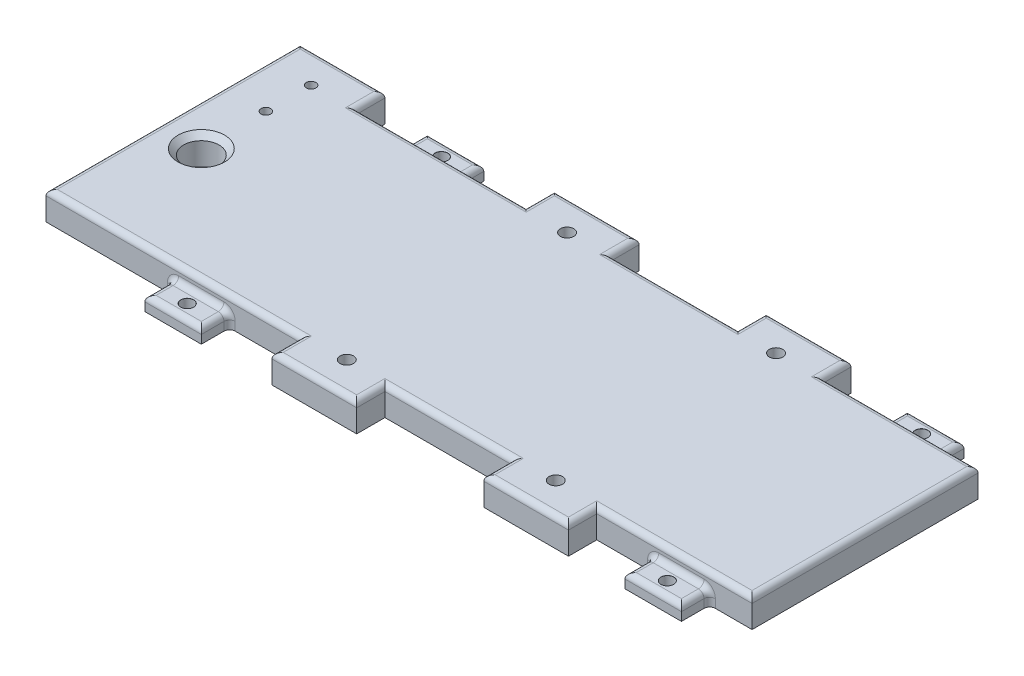
from build123d import *

# Parameters (mm, degrees)
SKETCH1_W                      = 260
SKETCH1_H                      = 100
BOSS_EXTRUDE1_DEPTH            = 10
SKETCH3_W                      = 55
SKETCH3_H                      = 10
SKETCH3_W_2                    = 60
SKETCH3_W_3                    = 45
CUT_EXTRUDE2_DEPTH             = 140.642400438
SKETCH5_W                      = 20
SKETCH5_H                      = 10
BOSS_EXTRUDE2_DEPTH            = 5
FILLET1_R                      = 2
SKETCH2_R                      = 6.25
CUT_EXTRUDE1_DEPTH             = 140.642400438
CHAMFER1_SIZE                  = 2
SKETCH4_R                      = 2.375
CUT_EXTRUDE3_DEPTH             = 6.2
M4_CLEARANCE_HOLE1_D           = 4.5
M4_CLEARANCE_HOLE1_CSINK_D     = 4.55
M4_CLEARANCE_HOLE1_CSINK_ANGLE = 90
M3_CLEARANCE_HOLE1_D           = 3.4
SKETCH13_R                     = 3.5
CUT_EXTRUDE4_DEPTH             = 5


with BuildPart() as part:
    # Sketch1 → Boss-Extrude1 (new body)
    with BuildSketch(Plane(origin=(0, 0, 0), x_dir=(1, 0, 0), z_dir=(0, 1, 0))):
        Rectangle(SKETCH1_W, SKETCH1_H)
    extrude(amount=BOSS_EXTRUDE1_DEPTH)

    # Sketch3 → Cut-Extrude2 (cut, through all)
    with BuildSketch(Plane(origin=(0, 10, 0), x_dir=(1, 0, 0), z_dir=(0, 1, 0))):
        with Locations((102.5, 45)):
            Rectangle(SKETCH3_W, SKETCH3_H)
        with Locations((102.5, -45)):
            Rectangle(SKETCH3_W, SKETCH3_H)
        Polygon((-130, -50), (-30, -50), (-30, -40), (-120, -40), (-120, 50), (-130, 50), (-130, -40), align=None)
        with Locations((-60, 45)):
            Rectangle(SKETCH3_W_2, SKETCH3_H)
        with Locations((22.5, 45)):
            Rectangle(SKETCH3_W_3, SKETCH3_H)
        with Locations((22.5, -45)):
            Rectangle(SKETCH3_W_3, SKETCH3_H)
    extrude(amount=-CUT_EXTRUDE2_DEPTH, mode=Mode.SUBTRACT)

    # Sketch5 → Boss-Extrude2 (add)
    with BuildSketch(Plane.XZ):
        with Locations((-65, 45)):
            Rectangle(SKETCH5_W, SKETCH5_H)
        with Locations((-65, -45)):
            Rectangle(SKETCH5_W, SKETCH5_H)
        with Locations((105, 45)):
            Rectangle(SKETCH5_W, SKETCH5_H)
        with Locations((105, -45)):
            Rectangle(SKETCH5_W, SKETCH5_H)
    extrude(amount=-BOSS_EXTRUDE2_DEPTH)

    # Fillet1
    fillet1_edges = [part.edges().sort_by_distance(p)[0] for p in [
        (130, 10, 0),
        (-60, 10, -40),
        (-30, 10, -45),
        (-15, 10, -50),
        (60, 10, -50),
        (75, 10, -45),
        (102.5, 10, -40),
        (102.5, 10, 40),
        (75, 10, 45),
        (-30, 10, 45),
        (-75, 10, 40),
        (-90, 10, -45),
        (60, 10, 50),
        (45, 10, 45),
        (22.5, 10, 40),
        (0, 10, 45),
        (-15, 10, 50),
        (0, 10, -45),
        (22.5, 10, -40),
        (45, 10, -45),
        (-120, 10, -5),
        (-105, 10, -50),
        (-75, 2.5, 40),
        (-55, 2.5, 40),
        (95, 2.5, 40),
        (115, 2.5, 40),
        (115, 2.5, -40),
        (95, 2.5, -40),
        (-55, 2.5, -40),
        (-75, 2.5, -40),
        (-65, 5, 40),
        (-55, 5, 45),
        (-65, 5, 50),
        (-75, 5, 45),
        (105, 5, 40),
        (115, 5, 45),
        (105, 5, 50),
        (95, 5, 45),
        (105, 5, -50),
        (115, 5, -45),
        (105, 5, -40),
        (95, 5, -45),
        (-65, 5, -50),
        (-55, 5, -45),
        (-65, 5, -40),
        (-75, 5, -45),
    ]]
    fillet(fillet1_edges, radius=FILLET1_R)

    # Sketch2 → Cut-Extrude1 (cut, through all)
    with BuildSketch(Plane(origin=(0, 10, 0), x_dir=(1, 0, 0), z_dir=(0, 1, 0))):
        with Locations((-105, 0)):
            Circle(SKETCH2_R)
    extrude(amount=-CUT_EXTRUDE1_DEPTH, mode=Mode.SUBTRACT)

    # Chamfer1
    chamfer1_edges = [part.edges().sort_by_distance(p)[0] for p in [
        (-111.25, 10, 0),
    ]]
    chamfer(chamfer1_edges, length=CHAMFER1_SIZE)

    # Sketch4 → Cut-Extrude3 (cut)
    with BuildSketch(Plane(origin=(0, 10, 0), x_dir=(1, 0, 0), z_dir=(0, 1, 0))):
        with Locations((59.5, 39)):
            Circle(SKETCH4_R)
        with Locations((-14.5, 39)):
            Circle(SKETCH4_R)
        with Locations((59.5, -39)):
            Circle(SKETCH4_R)
        with Locations((-14.5, -39)):
            Circle(SKETCH4_R)
    extrude(amount=-CUT_EXTRUDE3_DEPTH, mode=Mode.SUBTRACT)

    # M4 Clearance Hole1 (through all)
    with Locations(Plane(origin=(0, 5, 0), x_dir=(1, 0, 0), z_dir=(0, 1, 0))):
        with Locations((-65, 45), (105, 45), (105, -45), (-65, -45)):
            CounterSinkHole(M4_CLEARANCE_HOLE1_D / 2, M4_CLEARANCE_HOLE1_CSINK_D / 2, counter_sink_angle=M4_CLEARANCE_HOLE1_CSINK_ANGLE)

    # M3 Clearance Hole1 (through all)
    with Locations(Plane(origin=(0, 0, 0), x_dir=(-1, 0, 0), z_dir=(0, -1, 0))):
        with Locations((105, 38.858899), (105, 22.858899)):
            Hole(M3_CLEARANCE_HOLE1_D / 2)

    # Sketch13 → Cut-Extrude4 (cut)
    with BuildSketch(Plane.XZ):
        with Locations((-105, -22.858899)):
            Circle(SKETCH13_R)
        with Locations((-105, -38.858899)):
            Circle(SKETCH13_R)
    extrude(amount=-CUT_EXTRUDE4_DEPTH, mode=Mode.SUBTRACT)


solid = part.part
